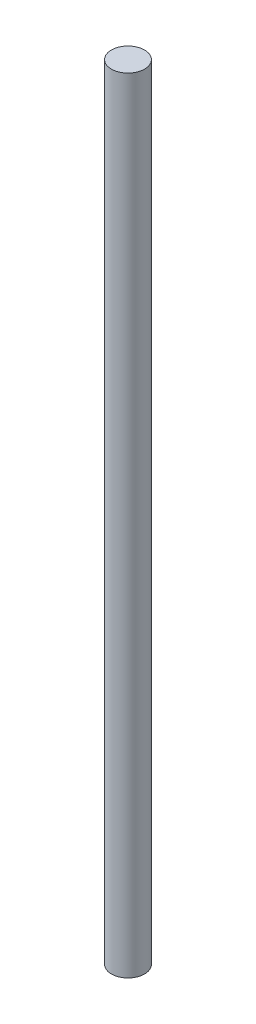
from build123d import *

# Parameters (mm, degrees)
SKETCH1_R           = 4.7625
BOSS_EXTRUDE1_DEPTH = 225


with BuildPart() as part:
    # Sketch1 → Boss-Extrude1 (new body)
    with BuildSketch(Plane(origin=(0, 0, 0), x_dir=(1, 0, 0), z_dir=(0, 1, 0))):
        Circle(SKETCH1_R)
    extrude(amount=BOSS_EXTRUDE1_DEPTH)


solid = part.part
